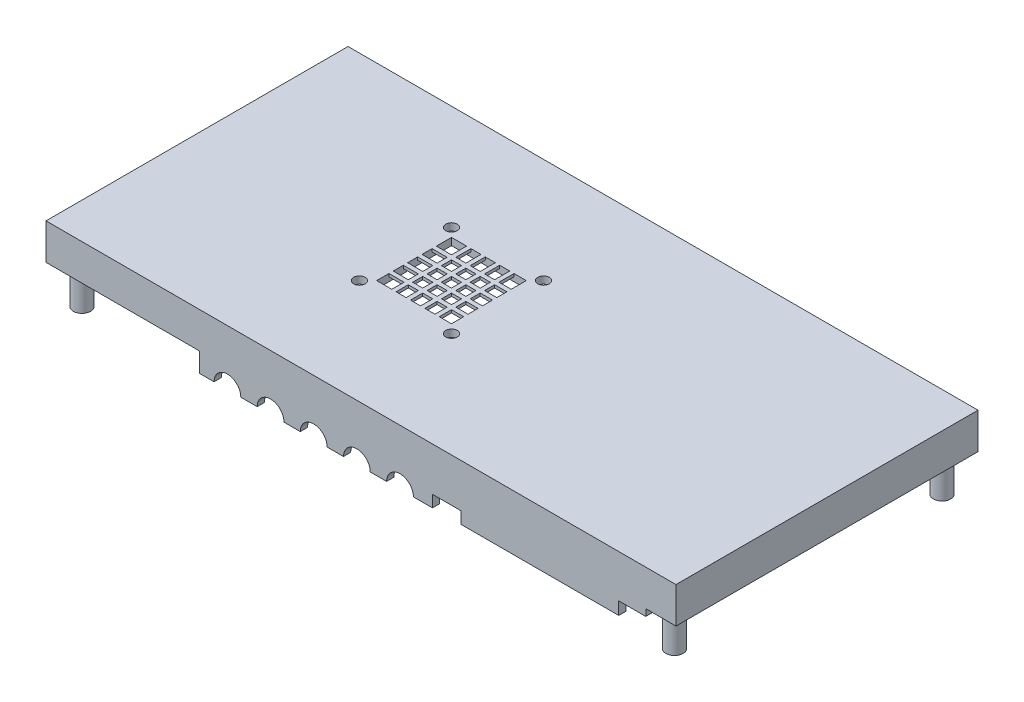
from build123d import *

# Parameters (mm, degrees)
SKETCH2_W             = 219
SKETCH2_H             = 105
BOSS_EXTRUDE1_DEPTH   = 2.5
SKETCH3_W             = 219
SKETCH3_H             = 105
SKETCH3_W_2           = 214
SKETCH3_H_2           = 100
BOSS_EXTRUDE2_DEPTH   = 10
SKETCH5_R             = 3
BOSS_EXTRUDE3_DEPTH   = 23
M3_TAPPED_HOLE1_D     = 2.5
M3_TAPPED_HOLE1_DEPTH = 10.1
M3_TAPPED_HOLE1_TIP   = 0.751075774
SKETCH8_R             = 2
CUT_EXTRUDE1_DEPTH    = 10
VENT1_START           = -34.039390763
VENT1_OUTLINE_W       = 1.5
VENT1_OUTLINE_H       = 26
VENT1_DEPTH           = 26
VENT1_2_OUTLINE_W     = 1
VENT1_2_OUTLINE_H     = 4.25
VENT1_2_OUTLINE_H_2   = 5.25
VENT1_2_OUTLINE_H_3   = 3.5
VENT1_2_DEPTH         = 5.25
VENT1_START_2         = -12.289390763
VENT1_3_OUTLINE_W     = 1
VENT1_3_OUTLINE_H     = 4.25
VENT1_3_OUTLINE_H_2   = 5.25
VENT1_3_OUTLINE_H_3   = 3.5
VENT1_3_DEPTH         = 4.25
VENT1_START_3         = -27.289390763
VENT1_4_OUTLINE_W     = 1
VENT1_4_OUTLINE_H     = 4.25
VENT1_4_OUTLINE_H_2   = 5.25
VENT1_4_OUTLINE_H_3   = 3.5
VENT1_4_DEPTH         = 3.5
VENT1_START_4         = -22.289390763
VENT1_5_OUTLINE_W     = 1
VENT1_5_OUTLINE_H     = 4.25
VENT1_5_OUTLINE_H_2   = 5.25
VENT1_5_OUTLINE_H_3   = 3.5
VENT1_5_DEPTH         = 3.5
VENT1_START_5         = -17.289390763
VENT1_6_OUTLINE_W     = 1
VENT1_6_OUTLINE_H     = 4.25
VENT1_6_OUTLINE_H_2   = 5.25
VENT1_6_OUTLINE_H_3   = 3.5
VENT1_6_DEPTH         = 3.5
BOSS_EXTRUDE4_DEPTH   = 2.5
BOSS_EXTRUDE5_DEPTH   = 2.5
SKETCH13_W            = 121.7
SKETCH13_H            = 3
CUT_EXTRUDE2_DEPTH    = 10
SKETCH14_W            = 125.7
SKETCH14_H            = 1.05
CUT_EXTRUDE3_DEPTH    = 5


# Read off the part's stored shape, not the designer's step: Vent1
with BuildPart() as part:
    # Sketch2 → Boss-Extrude1 (new body)
    with BuildSketch(Plane(origin=(0, 0, 0), x_dir=(1, 0, 0), z_dir=(0, 1, 0))):
        Rectangle(SKETCH2_W, SKETCH2_H)
    extrude(amount=BOSS_EXTRUDE1_DEPTH)

    # Sketch3 → Boss-Extrude2 (add)
    with BuildSketch(Plane.XZ):
        Rectangle(SKETCH3_W, SKETCH3_H)
        Rectangle(SKETCH3_W_2, SKETCH3_H_2, mode=Mode.SUBTRACT)
    extrude(amount=BOSS_EXTRUDE2_DEPTH)

    # Sketch5 → Boss-Extrude3 (add)
    with BuildSketch(Plane.XZ):
        with Locations(Location((103, -46.5, 0), (0, 0, 90))):
            Circle(SKETCH5_R)
        with Locations(Location((-103, -46.5, 0), (0, 0, 90))):
            Circle(SKETCH5_R)
        with Locations(Location((-103, 46.5, 0), (0, 0, 90))):
            Circle(SKETCH5_R)
        with Locations(Location((103, 46.5, 0), (0, 0, 90))):
            Circle(SKETCH5_R)
    extrude(amount=BOSS_EXTRUDE3_DEPTH)

    # M3 Tapped Hole1
    with Locations(Plane(origin=(0, -23, 0), x_dir=(-1, 0, 0), z_dir=(0, -1, 0))):
        with Locations((-103, 46.5), (103, 46.5), (103, -46.5), (-103, -46.5)):
            Hole(M3_TAPPED_HOLE1_D / 2, depth=M3_TAPPED_HOLE1_DEPTH)
            with Locations((0, 0, -(M3_TAPPED_HOLE1_DEPTH + M3_TAPPED_HOLE1_TIP / 2))):  # 118° drill point
                Cone(0, M3_TAPPED_HOLE1_D / 2, M3_TAPPED_HOLE1_TIP, mode=Mode.SUBTRACT)

    # Sketch8 → Cut-Extrude1 (cut)
    with BuildSketch(Plane(origin=(0, 2.5, 0), x_dir=(1, 0, 0), z_dir=(0, 1, 0))):
        with Locations(Location((-5.039390763, -16, 0), (0, 0, 270))):
            Circle(SKETCH8_R)
        with Locations(Location((-37.039390763, -16, 0), (0, 0, 270))):
            Circle(SKETCH8_R)
        with Locations(Location((-37.039390763, 16, 0), (0, 0, 270))):
            Circle(SKETCH8_R)
        with Locations(Location((-5.039390763, 16, 0), (0, 0, 270))):
            Circle(SKETCH8_R)
    extrude(amount=-CUT_EXTRUDE1_DEPTH, mode=Mode.SUBTRACT)

    # Vent1 outline → Vent1 (cut)
    with BuildSketch(Plane.YZ.offset(VENT1_START)):
        with Locations((0.75, 0)):
            Rectangle(VENT1_OUTLINE_W, VENT1_OUTLINE_H)
    extrude(amount=VENT1_DEPTH, mode=Mode.SUBTRACT)

    # Vent1 2 outline → Vent1 2 (cut)
    with BuildSketch(Plane.YZ.offset(VENT1_START)):
        with Locations((2, 10.875)):
            Rectangle(VENT1_2_OUTLINE_W, VENT1_2_OUTLINE_H)
        with Locations((2, -10.375)):
            Rectangle(VENT1_2_OUTLINE_W, VENT1_2_OUTLINE_H_2)
        with Locations((2, 5.5)):
            Rectangle(VENT1_2_OUTLINE_W, VENT1_2_OUTLINE_H_3)
        with Locations((2, -4.5)):
            Rectangle(VENT1_2_OUTLINE_W, VENT1_2_OUTLINE_H_3)
        with Locations((2, 0.5)):
            Rectangle(VENT1_2_OUTLINE_W, VENT1_2_OUTLINE_H_3)
    extrude(amount=VENT1_2_DEPTH, mode=Mode.SUBTRACT)

    # Vent1 3 outline → Vent1 3 (cut)
    with BuildSketch(Plane.YZ.offset(VENT1_START_2)):
        with Locations((2, 10.875)):
            Rectangle(VENT1_3_OUTLINE_W, VENT1_3_OUTLINE_H)
        with Locations((2, -10.375)):
            Rectangle(VENT1_3_OUTLINE_W, VENT1_3_OUTLINE_H_2)
        with Locations((2, 5.5)):
            Rectangle(VENT1_3_OUTLINE_W, VENT1_3_OUTLINE_H_3)
        with Locations((2, -4.5)):
            Rectangle(VENT1_3_OUTLINE_W, VENT1_3_OUTLINE_H_3)
        with Locations((2, 0.5)):
            Rectangle(VENT1_3_OUTLINE_W, VENT1_3_OUTLINE_H_3)
    extrude(amount=VENT1_3_DEPTH, mode=Mode.SUBTRACT)

    # Vent1 4 outline → Vent1 4 (cut)
    with BuildSketch(Plane.YZ.offset(VENT1_START_3)):
        with Locations((2, 10.875)):
            Rectangle(VENT1_4_OUTLINE_W, VENT1_4_OUTLINE_H)
        with Locations((2, -10.375)):
            Rectangle(VENT1_4_OUTLINE_W, VENT1_4_OUTLINE_H_2)
        with Locations((2, 5.5)):
            Rectangle(VENT1_4_OUTLINE_W, VENT1_4_OUTLINE_H_3)
        with Locations((2, -4.5)):
            Rectangle(VENT1_4_OUTLINE_W, VENT1_4_OUTLINE_H_3)
        with Locations((2, 0.5)):
            Rectangle(VENT1_4_OUTLINE_W, VENT1_4_OUTLINE_H_3)
    extrude(amount=VENT1_4_DEPTH, mode=Mode.SUBTRACT)

    # Vent1 5 outline → Vent1 5 (cut)
    with BuildSketch(Plane.YZ.offset(VENT1_START_4)):
        with Locations((2, 10.875)):
            Rectangle(VENT1_5_OUTLINE_W, VENT1_5_OUTLINE_H)
        with Locations((2, -10.375)):
            Rectangle(VENT1_5_OUTLINE_W, VENT1_5_OUTLINE_H_2)
        with Locations((2, 5.5)):
            Rectangle(VENT1_5_OUTLINE_W, VENT1_5_OUTLINE_H_3)
        with Locations((2, -4.5)):
            Rectangle(VENT1_5_OUTLINE_W, VENT1_5_OUTLINE_H_3)
        with Locations((2, 0.5)):
            Rectangle(VENT1_5_OUTLINE_W, VENT1_5_OUTLINE_H_3)
    extrude(amount=VENT1_5_DEPTH, mode=Mode.SUBTRACT)

    # Vent1 6 outline → Vent1 6 (cut)
    with BuildSketch(Plane.YZ.offset(VENT1_START_5)):
        with Locations((2, 10.875)):
            Rectangle(VENT1_6_OUTLINE_W, VENT1_6_OUTLINE_H)
        with Locations((2, -10.375)):
            Rectangle(VENT1_6_OUTLINE_W, VENT1_6_OUTLINE_H_2)
        with Locations((2, 5.5)):
            Rectangle(VENT1_6_OUTLINE_W, VENT1_6_OUTLINE_H_3)
        with Locations((2, -4.5)):
            Rectangle(VENT1_6_OUTLINE_W, VENT1_6_OUTLINE_H_3)
        with Locations((2, 0.5)):
            Rectangle(VENT1_6_OUTLINE_W, VENT1_6_OUTLINE_H_3)
    extrude(amount=VENT1_6_DEPTH, mode=Mode.SUBTRACT)

    # Sketch10 → Boss-Extrude4 (add)
    with BuildSketch(Plane.XY.offset(52.5)):
        with BuildLine():
            Line((18.22, -16.75), (22.72, -16.75))
            Line((22.72, -16.75), (22.72, -9.51))
            Line((22.72, -9.51), (-56.08, -9.51))
            Line((-56.08, -9.51), (-56.08, -16.75))
            Line((-56.08, -16.75), (-51.08, -16.75))
            ThreePointArc((-51.08, -16.75), (-46.43, -12.1), (-41.78, -16.75))
            Line((-41.78, -16.75), (-36.08, -16.75))
            ThreePointArc((-36.08, -16.75), (-31.43, -12.1), (-26.78, -16.75))
            Line((-26.78, -16.75), (-21.08, -16.75))
            ThreePointArc((-21.08, -16.75), (-16.43, -12.1), (-11.78, -16.75))
            Line((-11.78, -16.75), (-6.08, -16.75))
            ThreePointArc((-6.08, -16.75), (-1.43, -12.1), (3.22, -16.75))
            Line((3.22, -16.75), (8.92, -16.75))
            ThreePointArc((8.92, -16.75), (13.57, -12.1), (18.22, -16.75))
        make_face()
    extrude(amount=-BOSS_EXTRUDE4_DEPTH)

    # Sketch12 → Boss-Extrude5 (add)
    with BuildSketch(Plane.XY.offset(52.5)):
        Polygon((99, -10), (99, -12.35), (89.6, -12.35), (89.6, -16.75), (34.8, -16.75), (34.8, -12.65), (24.85, -12.65), (24.85, -16.75), (22.72, -16.75), (22.72, -10), align=None)
    extrude(amount=-BOSS_EXTRUDE5_DEPTH)

    # Sketch13 → Cut-Extrude2 (cut)
    with BuildSketch(Plane(origin=(0, 0, -52.5), x_dir=(-1, 0, 0), z_dir=(0, 0, -1))):
        with Locations((-5.19, -8.5)):
            Rectangle(SKETCH13_W, SKETCH13_H)
    extrude(amount=-CUT_EXTRUDE2_DEPTH, mode=Mode.SUBTRACT)

    # Sketch14 → Cut-Extrude3 (cut)
    with BuildSketch(Plane.XZ.offset(10)):
        with Locations((5.19, -51.25)):
            Rectangle(SKETCH14_W, SKETCH14_H)
    extrude(amount=-CUT_EXTRUDE3_DEPTH, mode=Mode.SUBTRACT)


solid = part.part
